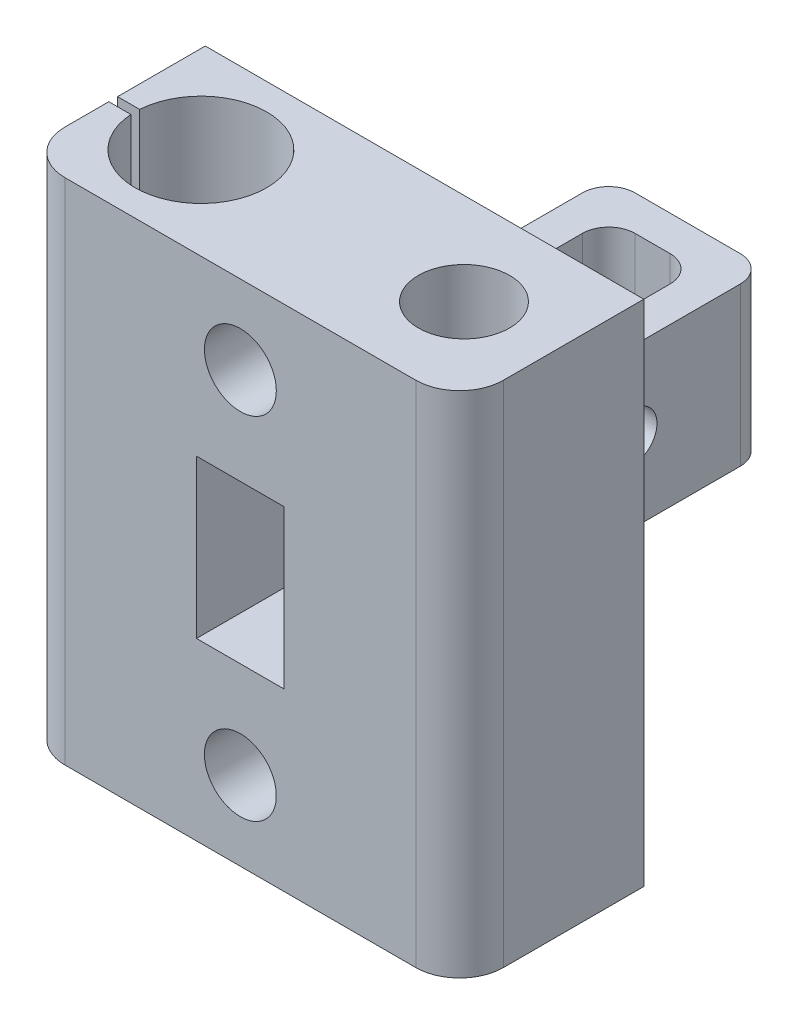
from build123d import *

# Parameters (mm, degrees)
SKETCH1_W           = 50
SKETCH1_H           = 21
BOSS_EXTRUDE1_DEPTH = 58
SKETCH3_R           = 7.5
CUT_EXTRUDE1_DEPTH  = 24
CUT_EXTRUDE2_REACH  = 66.025
SKETCH4_R           = 5.2
CUT_EXTRUDE3_START  = -24
SKETCH5_R           = 7.5
CUT_EXTRUDE3_DEPTH  = 24
CUT_EXTRUDE4_REACH  = 66.025
SKETCH6_R           = 4.5
CUT_EXTRUDE5_REACH  = 68.558
SKETCH8_W           = 10
SKETCH8_H           = 18
SKETCH7_R           = 4.1
CUT_EXTRUDE6_DEPTH  = 15
SKETCH11_W          = 4
SKETCH11_H          = 18
BOSS_EXTRUDE2_DEPTH = 26
SKETCH12_W          = 18
SKETCH12_H          = 18
BOSS_EXTRUDE3_DEPTH = 4
CUT_EXTRUDE7_DEPTH  = 79.487260113
FILLET1_R           = 5
FILLET2_R           = 5
FILLET3_R           = 3
SKETCH14_R          = 1.95
CUT_EXTRUDE8_DEPTH  = 10
SKETCH15_W          = 5.527864045
SKETCH15_H          = 1
CUT_EXTRUDE9_DEPTH  = 76.028327984


with BuildPart() as part:
    # Sketch1 → Boss-Extrude1 (new body)
    with BuildSketch(Plane(origin=(0, 0, 0), x_dir=(1, 0, 0), z_dir=(0, 1, 0))):
        Rectangle(SKETCH1_W, SKETCH1_H)
    extrude(amount=BOSS_EXTRUDE1_DEPTH)

    # Sketch3 → Cut-Extrude1 (cut)
    with BuildSketch(Plane(origin=(0, 58, 0), x_dir=(1, 0, 0), z_dir=(0, 1, 0))):
        with Locations((-15, 0)):
            Circle(SKETCH3_R)
    extrude(amount=-CUT_EXTRUDE1_DEPTH, mode=Mode.SUBTRACT)

    # Sketch4 → Cut-Extrude2 (cut, up to next)
    with BuildSketch(Plane(origin=(0, 58, 0), x_dir=(1, 0, 0), z_dir=(0, 1, 0)), mode=Mode.PRIVATE) as cut_extrude2_sk1:
        with Locations((15, 0)):
            Circle(SKETCH4_R)
    cut_extrude2_tool1 = extrude(cut_extrude2_sk1.sketch, amount=-CUT_EXTRUDE2_REACH, mode=Mode.PRIVATE) & part.part
    add(cut_extrude2_tool1.solids().sort_by_distance((15, 58, 0))[0], mode=Mode.SUBTRACT)

    # Sketch5 → Cut-Extrude3 (cut)
    with BuildSketch(Plane.XZ.offset(CUT_EXTRUDE3_START)):
        with Locations((-15, 0)):
            Circle(SKETCH5_R)
    extrude(amount=CUT_EXTRUDE3_DEPTH, mode=Mode.SUBTRACT)

    # Sketch6 → Cut-Extrude4 (cut, up to next)
    with BuildSketch(Plane.XZ, mode=Mode.PRIVATE) as cut_extrude4_sk1:
        with Locations((-15, 0)):
            Circle(SKETCH6_R)
    cut_extrude4_tool1 = extrude(cut_extrude4_sk1.sketch, amount=-CUT_EXTRUDE4_REACH, mode=Mode.PRIVATE) & part.part
    add(cut_extrude4_tool1.solids().sort_by_distance((-15, 0, 0))[0], mode=Mode.SUBTRACT)

    # Sketch8 → Cut-Extrude5 (cut, up to next)
    with BuildSketch(Plane.XY.offset(10.5), mode=Mode.PRIVATE) as cut_extrude5_sk1:
        with Locations((0, 29)):
            Rectangle(SKETCH8_W, SKETCH8_H)
    cut_extrude5_tool1 = extrude(cut_extrude5_sk1.sketch, amount=-CUT_EXTRUDE5_REACH, mode=Mode.PRIVATE) & part.part
    add(cut_extrude5_tool1.solids().sort_by_distance((0, 29, 10.5))[0], mode=Mode.SUBTRACT)

    # Sketch7 → Cut-Extrude6 (cut)
    with BuildSketch(Plane.XY.offset(10.5)):
        with Locations((0, 49)):
            Circle(SKETCH7_R)
        with Locations((0, 9)):
            Circle(SKETCH7_R)
    extrude(amount=-CUT_EXTRUDE6_DEPTH, mode=Mode.SUBTRACT)

    # Sketch11 → Boss-Extrude2 (add)
    with BuildSketch(Plane(origin=(0, 0, -10.5), x_dir=(-1, 0, 0), z_dir=(0, 0, -1))):
        with Locations((7, 29)):
            Rectangle(SKETCH11_W, SKETCH11_H)
        with Locations((-7, 29)):
            Rectangle(SKETCH11_W, SKETCH11_H)
    extrude(amount=BOSS_EXTRUDE2_DEPTH)

    # Sketch12 → Boss-Extrude3 (add)
    with BuildSketch(Plane(origin=(0, 0, -36.5), x_dir=(-1, 0, 0), z_dir=(0, 0, -1))):
        with Locations((0, 29)):
            Rectangle(SKETCH12_W, SKETCH12_H)
    extrude(amount=BOSS_EXTRUDE3_DEPTH)

    # Sketch13 → Cut-Extrude7 (cut, through all)
    with BuildSketch(Plane(origin=(9, 0, 0), x_dir=(0, 0, -1), z_dir=(1, 0, 0))):
        with BuildLine():
            Line((16.25, 31.75), (25.25, 31.75))
            ThreePointArc((25.25, 31.75), (28, 29), (25.25, 26.25))
            Line((25.25, 26.25), (16.25, 26.25))
            ThreePointArc((16.25, 26.25), (13.5, 29), (16.25, 31.75))
        make_face()
    extrude(amount=-CUT_EXTRUDE7_DEPTH, mode=Mode.SUBTRACT)

    # Fillet1
    fillet1_edges = [part.edges().sort_by_distance(p)[0] for p in [
        (-25, 29, 10.5),
        (25, 29, 10.5),
    ]]
    fillet(fillet1_edges, radius=FILLET1_R)

    # Fillet2
    fillet2_edges = [part.edges().sort_by_distance(p)[0] for p in [
        (-7, 20, -10.5),
        (7, 20, -10.5),
        (-7, 38, -10.5),
        (7, 38, -10.5),
    ]]
    fillet(fillet2_edges, radius=FILLET2_R)

    # Fillet3
    fillet3_edges = [part.edges().sort_by_distance(p)[0] for p in [
        (-5, 29, -36.5),
        (5, 29, -36.5),
        (-9, 29, -40.5),
        (9, 29, -40.5),
    ]]
    fillet(fillet3_edges, radius=FILLET3_R)

    # Sketch14 → Cut-Extrude8 (cut)
    with BuildSketch(Plane.XZ):
        with Locations((20.550788232, 5.550788232)):
            Circle(SKETCH14_R)
        with Locations((9.449211768, -5.550788232)):
            Circle(SKETCH14_R)
    extrude(amount=-CUT_EXTRUDE8_DEPTH, mode=Mode.SUBTRACT)

    # Sketch15 → Cut-Extrude9 (cut, through all)
    with BuildSketch(Plane(origin=(0, 58, 0), x_dir=(1, 0, 0), z_dir=(0, 1, 0))):
        with Locations((-22.236067977, 0)):
            Rectangle(SKETCH15_W, SKETCH15_H)
    extrude(amount=-CUT_EXTRUDE9_DEPTH, mode=Mode.SUBTRACT)


solid = part.part
